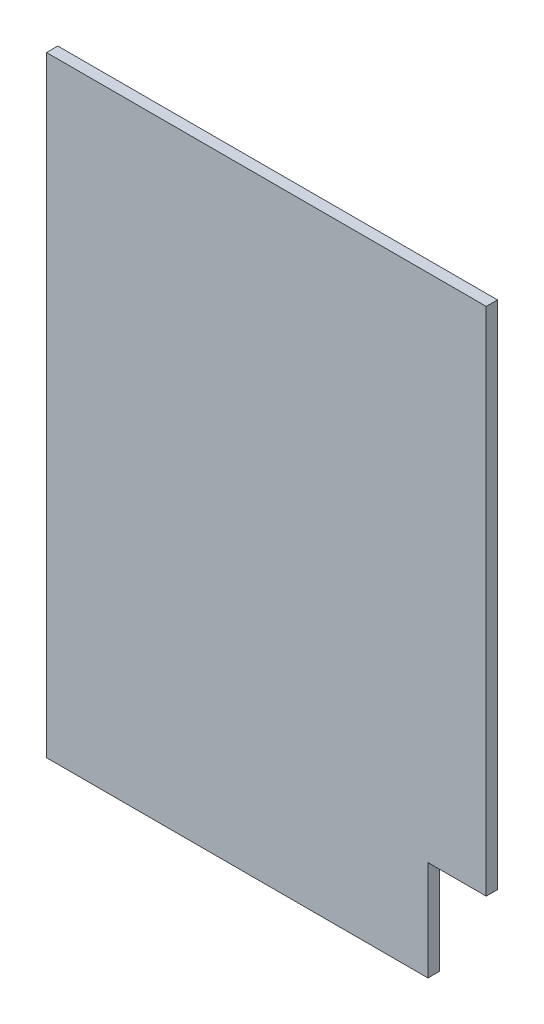
from build123d import *

# Parameters (mm, degrees)
BOSS_EXTRUDE1_DEPTH = 30


with BuildPart() as part:
    # Sketch1 → Boss-Extrude1 (new body)
    with BuildSketch(Plane.XY):
        Polygon((0, 0), (1015, 0), (1015, 266), (1170, 266), (1170, 1625), (0, 1625), align=None)
    extrude(amount=BOSS_EXTRUDE1_DEPTH)


solid = part.part
